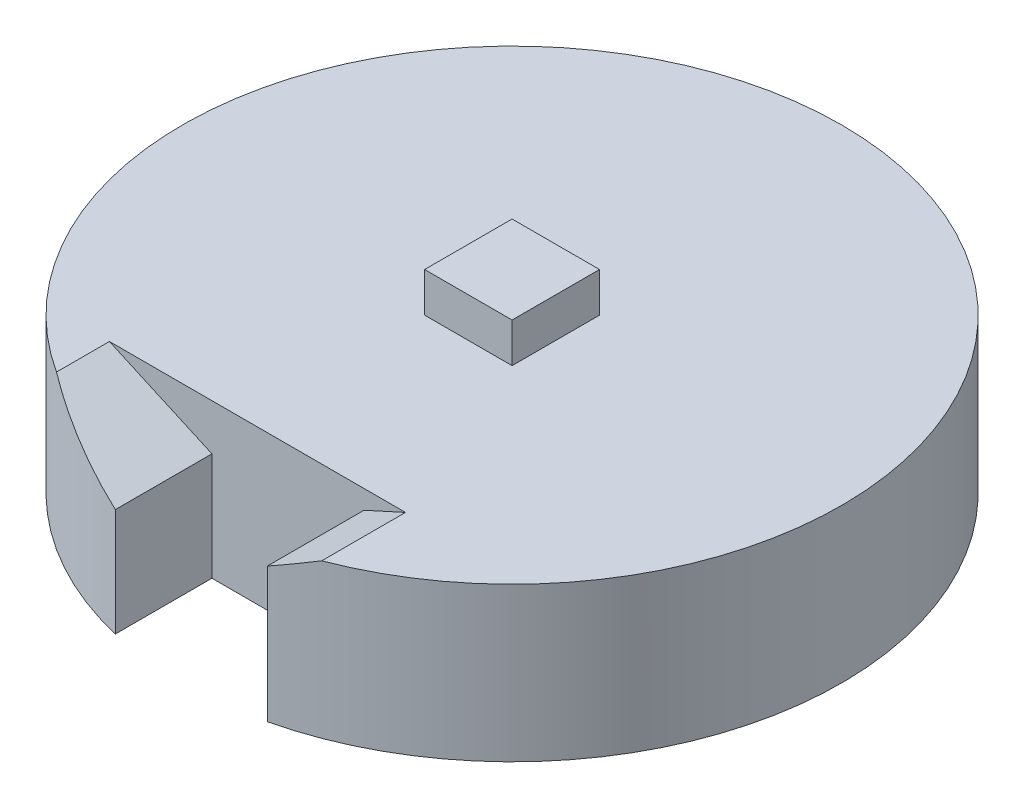
from build123d import *

# Parameters (mm, degrees)
SKETCH1_R           = 37.5
BOSS_EXTRUDE1_DEPTH = 17.5
CUT_EXTRUDE3_DEPTH  = 12
SKETCH9_W           = 9.95
SKETCH9_H           = 9.95
BOSS_EXTRUDE2_DEPTH = 22
SKETCH2_R           = 5
BOSS_EXTRUDE3_DEPTH = 5
CUT_EXTRUDE7_DEPTH  = 10
SKETCH12_R          = 3.025
CUT_EXTRUDE6_DEPTH  = 1.6


with BuildPart() as part:
    # Sketch1 → Boss-Extrude1 (new body)
    with BuildSketch(Plane(origin=(0, 0, 0), x_dir=(1, 0, 0), z_dir=(0, 1, 0))):
        Circle(SKETCH1_R)
    extrude(amount=BOSS_EXTRUDE1_DEPTH)

    # Sketch7 → Cut-Extrude3 (cut)
    with BuildSketch(Plane.XY.offset(37.5)):
        Polygon((-13.373540728, 17.5), (13.373540728, 17.5), (8.65, 15.352223508), (8.65, 0), (-8.65, 0), (-8.65, 12.2615131), (-20.313914492, 17.5), align=None)
    extrude(amount=-CUT_EXTRUDE3_DEPTH, mode=Mode.SUBTRACT)

    # Sketch9 → Boss-Extrude2 (add)
    with BuildSketch(Plane(origin=(0, 0, 0), x_dir=(1, 0, 0), z_dir=(0, 1, 0))):
        Rectangle(SKETCH9_W, SKETCH9_H)
    extrude(amount=BOSS_EXTRUDE2_DEPTH)

    # Sketch2 → Boss-Extrude3 (add)
    with BuildSketch(Plane.XZ):
        Circle(SKETCH2_R)
    extrude(amount=BOSS_EXTRUDE3_DEPTH)

    # Sketch11 → Cut-Extrude7 (cut)
    with BuildSketch(Plane.XZ.offset(5)):
        Polygon((0.0345929, 1.483882371), (-2.4654071, 1.483882371), (-2.4654071, -1.516117629), (2.5345929, -1.516117629), (2.5345929, 1.483882371), align=None)
    extrude(amount=-CUT_EXTRUDE7_DEPTH, mode=Mode.SUBTRACT)

    # Sketch12 → Cut-Extrude6 (cut)
    with BuildSketch(Plane(origin=(0, 0, 0), x_dir=(-1, 0, 0), z_dir=(0, -1, 0))):
        with Locations((-30.018011531, -0.006767597)):
            Circle(SKETCH12_R)
        with Locations((29.981988469, -0.006767597)):
            Circle(SKETCH12_R)
    extrude(amount=-CUT_EXTRUDE6_DEPTH, mode=Mode.SUBTRACT)


solid = part.part
